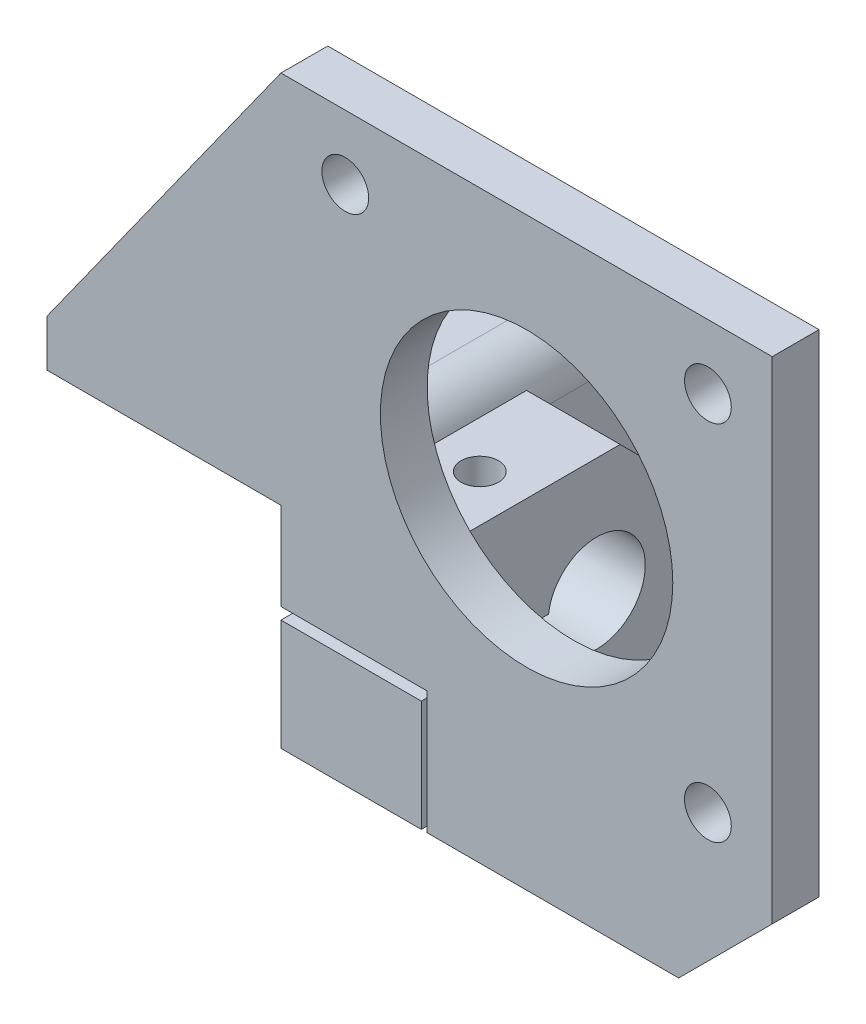
from build123d import *

# Parameters (mm, degrees)
ESBO_O1_R                  = 2
ESBO_O1_R_2                = 12.5
RESSALTO_EXTRUS_O1_DEPTH   = 4
RESSALTO_EXTRUS_O2_DEPTH   = 25
ESBO_O3_R                  = 4.15
RESSALTO_EXTRUS_O3_DEPTH   = 8
CORTE_EXTRUS_O1_DEPTH      = 8
CORTE_EXTRUS_O1_DEPTH_BACK = 8
CORTE_EXTRUS_O2_START      = -12
ESBO_O5_R                  = 1.75
ESBO_O5_R_2                = 4.15
CORTE_EXTRUS_O2_DEPTH      = 12
ESBO_O6_R                  = 1.75
CORTE_EXTRUS_O3_DEPTH      = 12
ESBO_O7_R                  = 1.6
CORTE_EXTRUS_O4_DEPTH      = 70.32532005


with BuildPart() as part:
    # Esboço1 → Ressalto-extrusão1 (new body)
    with BuildSketch(Plane.XY):
        Polygon((-21, -11), (-41, -11), (-41, -7), (-21, 21), (21, 21), (21, -21), (13, -29), (-21, -29), (-21, -21), align=None)
        with Locations((-15.5, 15.5)):
            Circle(ESBO_O1_R, mode=Mode.SUBTRACT)
        with Locations((15.5, 15.5)):
            Circle(ESBO_O1_R, mode=Mode.SUBTRACT)
        with Locations((15.5, -15.5)):
            Circle(ESBO_O1_R, mode=Mode.SUBTRACT)
        Circle(ESBO_O1_R_2, mode=Mode.SUBTRACT)
    extrude(amount=RESSALTO_EXTRUS_O1_DEPTH)

    # Esboço2 → Ressalto-extrusão2 (add)
    with BuildSketch(Plane(origin=(0, 0, 0), x_dir=(-1, 0, 0), z_dir=(0, 0, -1))):
        with BuildLine():
            Line((41, -11), (41, -7))
            Line((41, -7), (21, -7))
            ThreePointArc((21, -7), (18.171572875, -8.171572875), (17, -11))
            Line((17, -11), (17, -29))
            Line((17, -29), (21, -29))
            Line((21, -29), (21, -11))
            Line((21, -11), (41, -11))
        make_face()
    extrude(amount=RESSALTO_EXTRUS_O2_DEPTH)

    # Esboço3 → Ressalto-extrusão3 (add)
    with BuildSketch(Plane(origin=(-17, 0, 0), x_dir=(0, 0, -1), z_dir=(1, 0, 0))):
        Polygon((0, -9), (13, -9), (18, -14), (18, -24), (13, -29), (0, -29), align=None)
        with Locations((11, -19)):
            Circle(ESBO_O3_R, mode=Mode.SUBTRACT)
    extrude(amount=RESSALTO_EXTRUS_O3_DEPTH)

    # Esboço4 → Corte-extrusão1 (cut, two sides: drawn at the far end of the back side and taken through both)
    with BuildSketch(Plane(origin=(0, 0, 0), x_dir=(-1, 0, 0), z_dir=(0, 0, -1)).offset(-CORTE_EXTRUS_O1_DEPTH_BACK)):
        Polygon((8.5, -18.5), (21.5, -18.5), (21.5, -26), (21, -29), (21, -19.5), (9, -19.5), (9, -29), (8.5, -29), align=None)
    extrude(amount=CORTE_EXTRUS_O1_DEPTH + CORTE_EXTRUS_O1_DEPTH_BACK, mode=Mode.SUBTRACT)

    # Esboço5 → Corte-extrusão2 (cut)
    with BuildSketch(Plane(origin=(-17, 0, 0), x_dir=(0, 0, -1), z_dir=(1, 0, 0)).offset(CORTE_EXTRUS_O2_START)):
        with Locations((21, -21)):
            Circle(ESBO_O5_R)
        with Locations((11, -19)):
            Circle(ESBO_O5_R_2)
    extrude(amount=CORTE_EXTRUS_O2_DEPTH, mode=Mode.SUBTRACT)

    # Esboço6 → Corte-extrusão3 (cut)
    with BuildSketch(Plane(origin=(0, -7, 0), x_dir=(1, 0, 0), z_dir=(0, 1, 0))):
        with Locations((-31.5, 18)):
            Circle(ESBO_O6_R)
        with Locations((-31.5, -2)):
            Circle(ESBO_O6_R)
    extrude(amount=-CORTE_EXTRUS_O3_DEPTH, mode=Mode.SUBTRACT)

    # Esboço7 → Corte-extrusão4 (cut, through all)
    with BuildSketch(Plane.XZ.offset(29)):
        with Locations((-13, -5)):
            Circle(ESBO_O7_R)
    extrude(amount=-CORTE_EXTRUS_O4_DEPTH, mode=Mode.SUBTRACT)


solid = part.part
